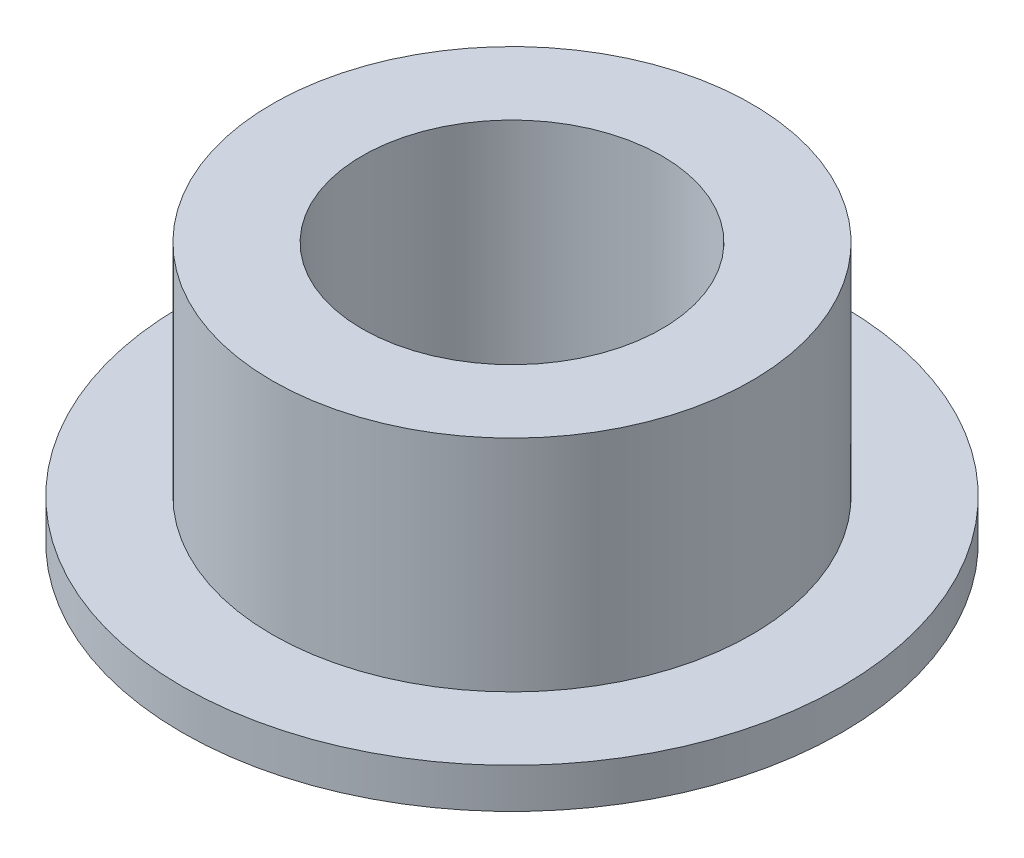
from build123d import *

# Parameters (mm, degrees)
SKETCH1_R           = 16.5
BOSS_EXTRUDE1_DEPTH = 2
SKETCH2_R           = 12
BOSS_EXTRUDE2_DEPTH = 11
SKETCH3_R           = 9
CUT_EXTRUDE1_DEPTH  = 1
SKETCH4_R           = 7.5
CUT_EXTRUDE2_DEPTH  = 12


with BuildPart() as part:
    # Sketch1 → Boss-Extrude1 (new body)
    with BuildSketch(Plane(origin=(0, 0, 0), x_dir=(1, 0, 0), z_dir=(0, 1, 0))):
        Circle(SKETCH1_R)
    extrude(amount=BOSS_EXTRUDE1_DEPTH)

    # Sketch2 → Boss-Extrude2 (add)
    with BuildSketch(Plane(origin=(0, 2, 0), x_dir=(1, 0, 0), z_dir=(0, 1, 0))):
        Circle(SKETCH2_R)
    extrude(amount=BOSS_EXTRUDE2_DEPTH)

    # Sketch3 → Cut-Extrude1 (cut)
    with BuildSketch(Plane.XZ):
        Circle(SKETCH3_R)
    extrude(amount=-CUT_EXTRUDE1_DEPTH, mode=Mode.SUBTRACT)

    # Sketch4 → Cut-Extrude2 (cut)
    with BuildSketch(Plane(origin=(0, 13, 0), x_dir=(1, 0, 0), z_dir=(0, 1, 0))):
        Circle(SKETCH4_R)
    extrude(amount=-CUT_EXTRUDE2_DEPTH, mode=Mode.SUBTRACT)


solid = part.part
